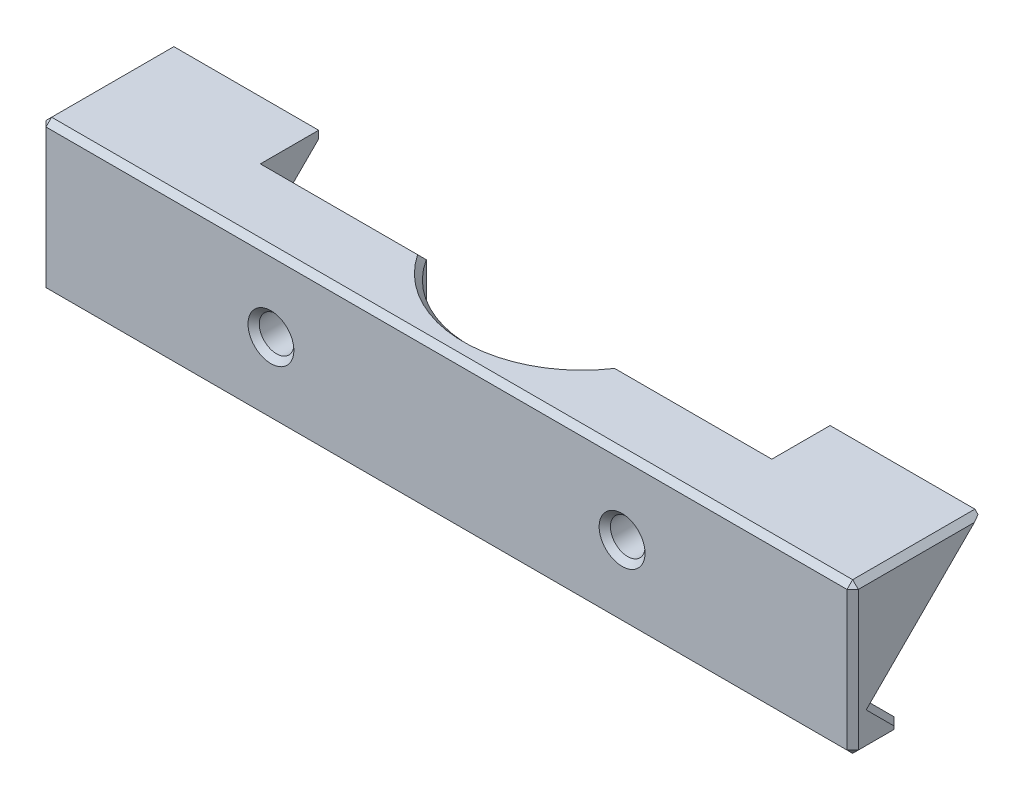
from build123d import *

# Parameters (mm, degrees)
SKIZZE1_W                       = 68
SKIZZE1_H                       = 20
AUFSATZ_LINEAR_AUSTRAGEN1_DEPTH = 10
AUFSATZ_LINEAR_AUSTRAGEN2_DEPTH = 20
SKIZZE3_R                       = 15
SCHNITT_LINEAR_AUSTRAGEN1_DEPTH = 20
SKIZZE4_R                       = 2.3
SCHNITT_LINEAR_AUSTRAGEN2_DEPTH = 10
SKIZZE5_R                       = 3.75
SCHNITT_LINEAR_AUSTRAGEN3_DEPTH = 3
SCHNITT_LINEAR_AUSTRAGEN4_DEPTH = 20
VERRUNDUNG1_R                   = 2


with BuildPart() as part:
    # Skizze1 → Aufsatz-Linear austragen1 (new body)
    with BuildSketch(Plane.XY):
        with Locations((0, 10)):
            Rectangle(SKIZZE1_W, SKIZZE1_H)
    extrude(amount=AUFSATZ_LINEAR_AUSTRAGEN1_DEPTH)

    # Skizze2 → Aufsatz-Linear austragen2 (add)
    with BuildSketch(Plane.ZY.offset(34)):
        Polygon((7.142135624, 4.857864376), (-7, 19), (-7, 20), (0, 20), (10, 20), (10, 0), (2.284271247, 0), align=None)
    aufsatz_linear_austragen2 = extrude(amount=AUFSATZ_LINEAR_AUSTRAGEN2_DEPTH)

    # Spiegeln1: Aufsatz-Linear austragen2 across plane
    add(aufsatz_linear_austragen2.mirror(Plane(origin=(0, 0, 0), x_dir=(0, 0, 1), z_dir=(1, 0, 0))))

    # Skizze3 → Schnitt-Linear austragen1 (cut)
    with BuildSketch(Plane.XZ):
        with Locations((0, -8)):
            Circle(SKIZZE3_R)
    extrude(amount=-SCHNITT_LINEAR_AUSTRAGEN1_DEPTH, mode=Mode.SUBTRACT)

    # Skizze4 → Schnitt-Linear austragen2 (cut)
    with BuildSketch(Plane(origin=(0, 0, 0), x_dir=(-1, 0, 0), z_dir=(0, 0, -1))):
        with Locations((-23.34428877, 10)):
            Circle(SKIZZE4_R)
        with Locations(Location((23.34428877, 10, 0), (0, 0, 180))):
            Circle(SKIZZE4_R)
    extrude(amount=-SCHNITT_LINEAR_AUSTRAGEN2_DEPTH, mode=Mode.SUBTRACT)

    # Skizze5 → Schnitt-Linear austragen3 (cut)
    with BuildSketch(Plane(origin=(0, 0, 0), x_dir=(-1, 0, 0), z_dir=(0, 0, -1))):
        with Locations((-23.34428877, 10)):
            Circle(SKIZZE5_R)
        with Locations((23.34428877, 10)):
            Circle(SKIZZE5_R)
    extrude(amount=-SCHNITT_LINEAR_AUSTRAGEN3_DEPTH, mode=Mode.SUBTRACT)

    # Skizze6 → Schnitt-Linear austragen4 (cut)
    with BuildSketch(Plane(origin=(54, 0, 0), x_dir=(0, 0, -1), z_dir=(1, 0, 0))):
        Polygon((-3.784271247, 1.5), (-3.784271247, 0), (-1.831080062, -0.949282867), (-1.396270995, 1.527811212), align=None)
    schnitt_linear_austragen4 = extrude(amount=-SCHNITT_LINEAR_AUSTRAGEN4_DEPTH, mode=Mode.SUBTRACT)

    # Spiegeln2: Schnitt-Linear austragen4 across plane
    add(schnitt_linear_austragen4.mirror(Plane(origin=(0, 0, 0), x_dir=(0, 0, 1), z_dir=(1, 0, 0))), mode=Mode.SUBTRACT)

    # Fase1
    # the kernel refuses this chamfer: 0.75 mm, written as the material it takes off along each edge
    with BuildSketch(Plane(origin=(53.5, 19.5, 9.5), x_dir=(-0.7071067811865476, 0.7071067811865476, 0), z_dir=(0.5773502691896257, 0.5773502691896257, 0.5773502691896257)), Plane(origin=(-53.5, 19.5, 9.5), x_dir=(-0.7071067811865476, -0.7071067811865476, 0), z_dir=(-0.5773502691896257, 0.5773502691896257, 0.5773502691896257))) as fase1_piece_1:
        Polygon((-0.530330086, -0.306186218), (0.530330086, -0.306186218), (0, 0.612372436), align=None)
    extrude(amount=0.952627944, mode=Mode.SUBTRACT)
    with BuildSketch(Plane(origin=(53.5, 0.5, 4.284271247), x_dir=(-0.7071067811865476, -1.2560739669470201e-15, -0.7071067811865476), z_dir=(0.5773502691896262, -0.577350269189626, -0.5773502691896252)), Plane(origin=(-53.5, 0.5, 9.5), x_dir=(-0.7071067811865476, 0.7071067811865474, 0), z_dir=(-0.5773502691896256, -0.5773502691896258, 0.5773502691896258)), Plane(origin=(-53.5, 0.5, 4.284271247), x_dir=(0, 0.707106781186547, -0.707106781186548), z_dir=(-0.577350269189626, -0.5773502691896262, -0.5773502691896253)), Plane(origin=(53.5, 0.5, 9.5), x_dir=(-0.7071067811865476, -0.7071067811865475, 0), z_dir=(0.5773502691896257, -0.5773502691896258, 0.5773502691896258))) as fase1_piece_2:
        Polygon((-0.530330086, 0.306186218), (0.530330086, 0.306186218), (0, -0.612372436), align=None)
    extrude(amount=0.952627944, mode=Mode.SUBTRACT)
    with BuildSketch(Plane(origin=(-23.34428877, 10, 10), x_dir=(1, 0, 0), z_dir=(0, 1, 0))) as fase1_piece_3:
        with BuildLine():
            Line((2.278786797, 0.771213203), (3.071213203, -0.021213203))
            Line((3.071213203, -0.021213203), (3.071213203, -0.036213203))
            ThreePointArc((3.071213203, -0.036213203), (2.685606602, -0.015), (2.3, -0.015))
            Line((2.3, -0.015), (2.285, 0))
            ThreePointArc((2.285, 0), (2.285, 0.385606602), (2.263786797, 0.771213203))
            Line((2.263786797, 0.771213203), (2.278786797, 0.771213203))
        make_face()
    revolve(axis=Axis((-23.34428877, 10, 10), (0, 0, -1)), mode=Mode.SUBTRACT)
    with BuildSketch(Plane(origin=(23.34428877, 10, 10), x_dir=(-1, 0, 0), z_dir=(0, -1, 0))) as fase1_piece_4:
        with BuildLine():
            Line((3.071213203, -0.021213203), (2.278786797, 0.771213203))
            Line((2.278786797, 0.771213203), (2.263786797, 0.771213203))
            ThreePointArc((2.263786797, 0.771213203), (2.285, 0.385606602), (2.285, 0))
            Line((2.285, 0), (2.3, -0.015))
            ThreePointArc((2.3, -0.015), (2.685606602, -0.015), (3.071213203, -0.036213203))
            Line((3.071213203, -0.036213203), (3.071213203, -0.021213203))
        make_face()
    revolve(axis=Axis((23.34428877, 10, 10), (0, 0, -1)), mode=Mode.SUBTRACT)
    with BuildSketch(Plane(origin=(54, 20, 0), x_dir=(-0.9996219169112968, 0.027495876610586893, 0), z_dir=(0, 0, 1))) as fase1_piece_5:
        with BuildLine():
            Line((0.771504896, 0), (-0.042410366, 0.770338345))
            Line((-0.042410366, 0.770338345), (-0.057404695, 0.769925907))
            ThreePointArc((-0.057404695, 0.769925907), (-0.02559692, 0.385048372), (-0.014994329, -0.000412438))
            Line((-0.014994329, -0.000412438), (0.000412438, -0.014994329))
            ThreePointArc((0.000412438, -0.014994329), (0.385873249, -0.004391737), (0.771917335, -0.014994329))
            Line((0.771917335, -0.014994329), (0.771504896, 0))
        make_face()
    extrude(amount=11.928762241, mode=Mode.SUBTRACT)
    with BuildSketch(Plane(origin=(54, 4.857864376, 7.142135624), x_dir=(-0.9996219169112968, -0.01944252080601377, -0.01944252080601398), z_dir=(0, 0.7071067811865513, -0.7071067811865438)), Plane(origin=(55.928762241, 0, 3.784271247), x_dir=(0, -0.027495876610586376, 0.9996219169112968), z_dir=(-1, 0, 0))) as fase1_piece_6:
        with BuildLine():
            Line((0.771504896, 0), (-0.042410366, 0.770338345))
            Line((-0.042410366, 0.770338345), (-0.057404695, 0.769925907))
            ThreePointArc((-0.057404695, 0.769925907), (-0.02559692, 0.385048372), (-0.014994329, -0.000412438))
            Line((-0.014994329, -0.000412438), (0.000412438, -0.014994329))
            ThreePointArc((0.000412438, -0.014994329), (0.385873249, -0.004391737), (0.771917335, -0.014994329))
            Line((0.771917335, -0.014994329), (0.771504896, 0))
        make_face()
    extrude(amount=21.928762241, mode=Mode.SUBTRACT)
    with BuildSketch(Plane(origin=(54, 0.13615914, 2.420430388), x_dir=(-0.9996219169112968, 0.01944252080601445, -0.019442520806014447), z_dir=(0, 0.7071067811865475, 0.7071067811865476))) as fase1_piece_7:
        with BuildLine():
            Line((0.771504896, 0), (-0.042410366, 0.770338345))
            Line((-0.042410366, 0.770338345), (-0.057404695, 0.769925907))
            ThreePointArc((-0.057404695, 0.769925907), (-0.02559692, 0.385048372), (-0.014994329, -0.000412438))
            Line((-0.014994329, -0.000412438), (0.000412438, -0.014994329))
            ThreePointArc((0.000412438, -0.014994329), (0.385873249, -0.004391737), (0.771917335, -0.014994329))
            Line((0.771917335, -0.014994329), (0.771504896, 0))
        make_face()
    extrude(amount=6.677499583, mode=Mode.SUBTRACT)
    with BuildSketch(Plane(origin=(54, 3.428762241, 3.784271247), x_dir=(0.027495876610582164, 0, 0.9996219169112969), z_dir=(0, -1, 0)), Plane(origin=(-54, 3.428762241, 3.784271247), x_dir=(0.9996219169112968, 0, -0.027495876610586317), z_dir=(0, -1, 0))) as fase1_piece_8:
        with BuildLine():
            Line((0.771504896, 0), (-0.042410366, 0.770338345))
            Line((-0.042410366, 0.770338345), (-0.057404695, 0.769925907))
            ThreePointArc((-0.057404695, 0.769925907), (-0.02559692, 0.385048372), (-0.014994329, -0.000412438))
            Line((-0.014994329, -0.000412438), (0.000412438, -0.014994329))
            ThreePointArc((0.000412438, -0.014994329), (0.385873249, -0.004391737), (0.771917335, -0.014994329))
            Line((0.771917335, -0.014994329), (0.771504896, 0))
        make_face()
    extrude(amount=5.357524482, mode=Mode.SUBTRACT)
    with BuildSketch(Plane(origin=(-54, 0, 11.928762241), x_dir=(0.9996219169112968, -0.027495876610586487, 0), z_dir=(0, 0, -1))) as fase1_piece_9:
        with BuildLine():
            Line((0.771504896, 0), (-0.042410366, -0.770338345))
            Line((-0.042410366, -0.770338345), (-0.057404695, -0.769925907))
            ThreePointArc((-0.057404695, -0.769925907), (-0.02559692, -0.385048372), (-0.014994329, 0.000412438))
            Line((-0.014994329, 0.000412438), (0.000412438, 0.014994329))
            ThreePointArc((0.000412438, 0.014994329), (0.385873249, 0.004391737), (0.771917335, 0.014994329))
            Line((0.771917335, 0.014994329), (0.771504896, 0))
        make_face()
    extrude(amount=10.073253234, mode=Mode.SUBTRACT)
    with BuildSketch(Plane(origin=(54, 21.928762241, 10), x_dir=(-0.9996219169112968, 0, 0.027495876610586893), z_dir=(0, -1, 0)), Plane(origin=(-54, 21.928762241, 10), x_dir=(-0.027495876610582164, 0, -0.9996219169112969), z_dir=(0, -1, 0))) as fase1_piece_10:
        with BuildLine():
            Line((0.771504896, 0), (-0.042410366, 0.770338345))
            Line((-0.042410366, 0.770338345), (-0.057404695, 0.769925907))
            ThreePointArc((-0.057404695, 0.769925907), (-0.02559692, 0.385048372), (-0.014994329, -0.000412438))
            Line((-0.014994329, -0.000412438), (0.000412438, -0.014994329))
            ThreePointArc((0.000412438, -0.014994329), (0.385873249, -0.004391737), (0.771917335, -0.014994329))
            Line((0.771917335, -0.014994329), (0.771504896, 0))
        make_face()
    extrude(amount=23.857524482, mode=Mode.SUBTRACT)
    with BuildSketch(Plane(origin=(55.928762241, 20, 10), x_dir=(0, 0.027495876610586768, -0.9996219169112968), z_dir=(-1, 0, 0))) as fase1_piece_11:
        with BuildLine():
            Line((0.771504896, 0), (-0.042410366, 0.770338345))
            Line((-0.042410366, 0.770338345), (-0.057404695, 0.769925907))
            ThreePointArc((-0.057404695, 0.769925907), (-0.02559692, 0.385048372), (-0.014994329, -0.000412438))
            Line((-0.014994329, -0.000412438), (0.000412438, -0.014994329))
            ThreePointArc((0.000412438, -0.014994329), (0.385873249, -0.004391737), (0.771917335, -0.014994329))
            Line((0.771917335, -0.014994329), (0.771504896, 0))
        make_face()
    extrude(amount=111.857524482, mode=Mode.SUBTRACT)
    with BuildSketch(Plane(origin=(55.928762241, 0, 10), x_dir=(0, -0.02749587661058636, -0.9996219169112968), z_dir=(-1, 0, 0))) as fase1_piece_12:
        with BuildLine():
            Line((0.771504896, 0), (-0.042410366, -0.770338345))
            Line((-0.042410366, -0.770338345), (-0.057404695, -0.769925907))
            ThreePointArc((-0.057404695, -0.769925907), (-0.02559692, -0.385048372), (-0.014994329, 0.000412438))
            Line((-0.014994329, 0.000412438), (0.000412438, 0.014994329))
            ThreePointArc((0.000412438, 0.014994329), (0.385873249, 0.004391737), (0.771917335, 0.014994329))
            Line((0.771917335, 0.014994329), (0.771504896, 0))
        make_face()
    extrude(amount=111.857524482, mode=Mode.SUBTRACT)
    with BuildSketch(Plane(origin=(54, 0, 11.928762241), x_dir=(-0.9996219169112968, -0.027495876610586487, 0), z_dir=(0, 0, -1))) as fase1_piece_13:
        with BuildLine():
            Line((0.771504896, 0), (-0.042410366, 0.770338345))
            Line((-0.042410366, 0.770338345), (-0.057404695, 0.769925907))
            ThreePointArc((-0.057404695, 0.769925907), (-0.02559692, 0.385048372), (-0.014994329, -0.000412438))
            Line((-0.014994329, -0.000412438), (0.000412438, -0.014994329))
            ThreePointArc((0.000412438, -0.014994329), (0.385873249, -0.004391737), (0.771917335, -0.014994329))
            Line((0.771917335, -0.014994329), (0.771504896, 0))
        make_face()
    extrude(amount=10.073253234, mode=Mode.SUBTRACT)
    with BuildSketch(Plane(origin=(34, 0, -1.928762241), x_dir=(-0.9996219169112968, -0.027495876610586487, 0), z_dir=(0, 0, 1)), Plane(origin=(-34, 0, 3.784271247), x_dir=(0.9996219169112968, -0.027495876610585248, 0), z_dir=(0, 0, -1))) as fase1_piece_14:
        with BuildLine():
            Line((0.771504896, 0), (-0.042410366, -0.770338345))
            Line((-0.042410366, -0.770338345), (-0.057404695, -0.769925907))
            ThreePointArc((-0.057404695, -0.769925907), (-0.02559692, -0.385048372), (-0.014994329, 0.000412438))
            Line((-0.014994329, 0.000412438), (0.000412438, 0.014994329))
            ThreePointArc((0.000412438, 0.014994329), (0.385873249, 0.004391737), (0.771917335, 0.014994329))
            Line((0.771917335, 0.014994329), (0.771504896, 0))
        make_face()
    extrude(amount=5.713033488, mode=Mode.SUBTRACT)
    with BuildSketch(Plane(origin=(35.928762241, 0, 0), x_dir=(0, -0.027495876610586372, 0.9996219169112968), z_dir=(-1, 0, 0)), Plane(origin=(-10.759815299, 0, 0), x_dir=(0, -0.027495876610586372, 0.9996219169112968), z_dir=(-1, 0, 0))) as fase1_piece_15:
        with BuildLine():
            Line((0.771504896, 0), (-0.042410366, 0.770338345))
            Line((-0.042410366, 0.770338345), (-0.057404695, 0.769925907))
            ThreePointArc((-0.057404695, 0.769925907), (-0.02559692, 0.385048372), (-0.014994329, -0.000412438))
            Line((-0.014994329, -0.000412438), (0.000412438, -0.014994329))
            ThreePointArc((0.000412438, -0.014994329), (0.385873249, -0.004391737), (0.771917335, -0.014994329))
            Line((0.771917335, -0.014994329), (0.771504896, 0))
        make_face()
    extrude(amount=25.168946941, mode=Mode.SUBTRACT)
    with BuildSketch(Plane(origin=(0, 0, -8), x_dir=(0.9073469377071577, 0, 0.42038260505573166), z_dir=(0.42038260505573166, 0, -0.9073469377071577))) as fase1_piece_16:
        with BuildLine():
            Line((15.771213203, 0.021213203), (14.978786797, -0.771213203))
            Line((14.978786797, -0.771213203), (14.963786797, -0.771213203))
            ThreePointArc((14.963786797, -0.771213203), (14.985, -0.385606602), (14.985, 0))
            Line((14.985, 0), (15, 0.015))
            ThreePointArc((15, 0.015), (15.385606602, 0.015), (15.771213203, 0.036213203))
            Line((15.771213203, 0.036213203), (15.771213203, 0.021213203))
        make_face()
    revolve(axis=Axis((0, 0, -8), (0, -1, 0)), revolution_arc=130.282509401, mode=Mode.SUBTRACT)
    with BuildSketch(Plane(origin=(-55.928762241, 0, 3.784271247), x_dir=(0, -0.027495876610586376, 0.9996219169112968), z_dir=(1, 0, 0)), Plane(origin=(-54, 4.857864376, 7.142135624), x_dir=(0.9996219169112968, -0.01944252080601377, -0.01944252080601398), z_dir=(0, 0.7071067811865513, -0.7071067811865438))) as fase1_piece_17:
        with BuildLine():
            Line((0.771504896, 0), (-0.042410366, -0.770338345))
            Line((-0.042410366, -0.770338345), (-0.057404695, -0.769925907))
            ThreePointArc((-0.057404695, -0.769925907), (-0.02559692, -0.385048372), (-0.014994329, 0.000412438))
            Line((-0.014994329, 0.000412438), (0.000412438, 0.014994329))
            ThreePointArc((0.000412438, 0.014994329), (0.385873249, 0.004391737), (0.771917335, 0.014994329))
            Line((0.771917335, 0.014994329), (0.771504896, 0))
        make_face()
    extrude(amount=21.928762241, mode=Mode.SUBTRACT)
    with BuildSketch(Plane(origin=(-54, 0.13615914, 2.420430388), x_dir=(0.9996219169112968, 0.01944252080601436, -0.019442520806014357), z_dir=(0, 0.7071067811865475, 0.7071067811865476))) as fase1_piece_18:
        with BuildLine():
            Line((0.771504896, 0), (-0.042410366, -0.770338345))
            Line((-0.042410366, -0.770338345), (-0.057404695, -0.769925907))
            ThreePointArc((-0.057404695, -0.769925907), (-0.02559692, -0.385048372), (-0.014994329, 0.000412438))
            Line((-0.014994329, 0.000412438), (0.000412438, 0.014994329))
            ThreePointArc((0.000412438, 0.014994329), (0.385873249, 0.004391737), (0.771917335, 0.014994329))
            Line((0.771917335, 0.014994329), (0.771504896, 0))
        make_face()
    extrude(amount=6.677499583, mode=Mode.SUBTRACT)
    with BuildSketch(Plane(origin=(-34, 20, 0), x_dir=(0, 0.027495876610586778, 0.9996219169112968), z_dir=(1, 0, 0)), Plane(origin=(10.759815299, 20, 0), x_dir=(0, 0.027495876610586778, 0.9996219169112968), z_dir=(1, 0, 0))) as fase1_piece_19:
        with BuildLine():
            Line((0.771504896, 0), (-0.042410366, 0.770338345))
            Line((-0.042410366, 0.770338345), (-0.057404695, 0.769925907))
            ThreePointArc((-0.057404695, 0.769925907), (-0.02559692, 0.385048372), (-0.014994329, -0.000412438))
            Line((-0.014994329, -0.000412438), (0.000412438, -0.014994329))
            ThreePointArc((0.000412438, -0.014994329), (0.385873249, -0.004391737), (0.771917335, -0.014994329))
            Line((0.771917335, -0.014994329), (0.771504896, 0))
        make_face()
    extrude(amount=23.240184701, mode=Mode.SUBTRACT)
    with BuildSketch(Plane(origin=(0, 20, -8), x_dir=(0.9073469377071578, 0, 0.42038260505573166), z_dir=(0.42038260505573166, 0, -0.9073469377071578))) as fase1_piece_20:
        with BuildLine():
            Line((14.978786797, 0.771213203), (15.771213203, -0.021213203))
            Line((15.771213203, -0.021213203), (15.771213203, -0.036213203))
            ThreePointArc((15.771213203, -0.036213203), (15.385606602, -0.015), (15, -0.015))
            Line((15, -0.015), (14.985, 0))
            ThreePointArc((14.985, 0), (14.985, 0.385606602), (14.963786797, 0.771213203))
            Line((14.963786797, 0.771213203), (14.978786797, 0.771213203))
        make_face()
    revolve(axis=Axis((0, 20, -8), (0, -1, 0)), revolution_arc=130.282509401, mode=Mode.SUBTRACT)
    with BuildSketch(Plane(origin=(-54, 20, 0), x_dir=(0.9996219169112968, 0.027495876610586893, 0), z_dir=(0, 0, 1))) as fase1_piece_21:
        with BuildLine():
            Line((0.771504896, 0), (-0.042410366, -0.770338345))
            Line((-0.042410366, -0.770338345), (-0.057404695, -0.769925907))
            ThreePointArc((-0.057404695, -0.769925907), (-0.02559692, -0.385048372), (-0.014994329, 0.000412438))
            Line((-0.014994329, 0.000412438), (0.000412438, 0.014994329))
            ThreePointArc((0.000412438, 0.014994329), (0.385873249, 0.004391737), (0.771917335, 0.014994329))
            Line((0.771917335, 0.014994329), (0.771504896, 0))
        make_face()
    extrude(amount=11.928762241, mode=Mode.SUBTRACT)
    with BuildSketch(Plane(origin=(-54, 20, -8.928762241), x_dir=(0.9996219169112968, 0.027495876610586893, -2.912407812628222e-14), z_dir=(0, 1.059216206806384e-12, 1.0))) as fase1_piece_22:
        with BuildLine():
            Line((0.771504896, 0), (-0.042410366, -0.770338345))
            Line((-0.042410366, -0.770338345), (-0.057404695, -0.769925907))
            ThreePointArc((-0.057404695, -0.769925907), (-0.02559692, -0.385048372), (-0.014994329, 0.000412438))
            Line((-0.014994329, 0.000412438), (0.000412438, 0.014994329))
            ThreePointArc((0.000412438, 0.014994329), (0.385873249, 0.004391737), (0.771917335, 0.014994329))
            Line((0.771917335, 0.014994329), (0.771504896, 0))
        make_face()
    extrude(amount=8.928762241, mode=Mode.SUBTRACT)
    with BuildSketch(Plane(origin=(54, 20, -8.928762241), x_dir=(-0.9996219169112968, 0.027495876610586893, -2.912407812628222e-14), z_dir=(0, 1.059216206806384e-12, 1.0))) as fase1_piece_23:
        with BuildLine():
            Line((0.771504896, 0), (-0.042410366, 0.770338345))
            Line((-0.042410366, 0.770338345), (-0.057404695, 0.769925907))
            ThreePointArc((-0.057404695, 0.769925907), (-0.02559692, 0.385048372), (-0.014994329, -0.000412438))
            Line((-0.014994329, -0.000412438), (0.000412438, -0.014994329))
            ThreePointArc((0.000412438, -0.014994329), (0.385873249, -0.004391737), (0.771917335, -0.014994329))
            Line((0.771917335, -0.014994329), (0.771504896, 0))
        make_face()
    extrude(amount=8.928762241, mode=Mode.SUBTRACT)
    with BuildSketch(Plane(origin=(54, 3.494023516, 8.505976484), x_dir=(-0.9996219169112968, -0.01944252080601521, -0.019442520806015415), z_dir=(0, 0.7071067811865513, -0.7071067811865438))) as fase1_piece_24a_section:
        with BuildLine():
            Line((0.771504896, 0), (-0.042410366, 0.770338345))
            Line((-0.042410366, 0.770338345), (-0.057404695, 0.769925907))
            ThreePointArc((-0.057404695, 0.769925907), (-0.02559692, 0.385048372), (-0.014994329, -0.000412438))
            Line((-0.014994329, -0.000412438), (0.000412438, -0.014994329))
            ThreePointArc((0.000412438, -0.014994329), (0.385873249, -0.004391737), (0.771917335, -0.014994329))
            Line((0.771917335, -0.014994329), (0.771504896, 0))
        make_face()
    fase1_piece_24a = extrude(amount=23.857524482, mode=Mode.PRIVATE)
    fase1_piece_24a = split(fase1_piece_24a, bisect_by=Plane(origin=(53.75265478, 5.032763859, 7.317035106), z_dir=(0, -0.7071067811865476, 0.7071067811865475)), keep=Keep.TOP, mode=Mode.PRIVATE)
    with BuildSketch(Plane(origin=(54, 0.13615914, 2.420430388), x_dir=(-0.9996219169112968, 0.01944252080601445, -0.019442520806014447), z_dir=(0, 0.7071067811865475, 0.7071067811865476))) as fase1_piece_24b_section:
        with BuildLine():
            Line((0.771504896, 0), (-0.042410366, 0.770338345))
            Line((-0.042410366, 0.770338345), (-0.057404695, 0.769925907))
            ThreePointArc((-0.057404695, 0.769925907), (-0.02559692, 0.385048372), (-0.014994329, -0.000412438))
            Line((-0.014994329, -0.000412438), (0.000412438, -0.014994329))
            ThreePointArc((0.000412438, -0.014994329), (0.385873249, -0.004391737), (0.771917335, -0.014994329))
            Line((0.771917335, -0.014994329), (0.771504896, 0))
        make_face()
    fase1_piece_24b = extrude(amount=8.606261823, mode=Mode.PRIVATE)
    fase1_piece_24b = split(fase1_piece_24b, bisect_by=Plane(origin=(53.75265478, 4.682964894, 7.317035106), z_dir=(0, 0.7071067811865438, 0.7071067811865513)), keep=Keep.TOP, mode=Mode.PRIVATE)
    fase1_piece_24 = fase1_piece_24a & fase1_piece_24b
    add(fase1_piece_24, mode=Mode.SUBTRACT)
    with BuildSketch(Plane(origin=(34, 0, -1.928762241), x_dir=(-0.9996219169112968, -0.027495876610586487, 0), z_dir=(0, 0, 1))) as fase1_piece_25a_section:
        with BuildLine():
            Line((0.771504896, 0), (-0.042410366, -0.770338345))
            Line((-0.042410366, -0.770338345), (-0.057404695, -0.769925907))
            ThreePointArc((-0.057404695, -0.769925907), (-0.02559692, -0.385048372), (-0.014994329, 0.000412438))
            Line((-0.014994329, 0.000412438), (0.000412438, 0.014994329))
            ThreePointArc((0.000412438, 0.014994329), (0.385873249, 0.004391737), (0.771917335, 0.014994329))
            Line((0.771917335, 0.014994329), (0.771504896, 0))
        make_face()
    fase1_piece_25a = extrude(amount=7.641795729, mode=Mode.PRIVATE)
    fase1_piece_25a = split(fase1_piece_25a, bisect_by=Plane(origin=(33.75265478, 0.24734522, 3.784271247), z_dir=(0, 0, 1)), keep=Keep.TOP, mode=Mode.PRIVATE)
    with BuildSketch(Plane(origin=(55.928762241, 0, 3.784271247), x_dir=(0, -0.027495876610586376, 0.9996219169112968), z_dir=(-1, 0, 0))) as fase1_piece_25b_section:
        with BuildLine():
            Line((0.771504896, 0), (-0.042410366, 0.770338345))
            Line((-0.042410366, 0.770338345), (-0.057404695, 0.769925907))
            ThreePointArc((-0.057404695, 0.769925907), (-0.02559692, 0.385048372), (-0.014994329, -0.000412438))
            Line((-0.014994329, -0.000412438), (0.000412438, -0.014994329))
            ThreePointArc((0.000412438, -0.014994329), (0.385873249, -0.004391737), (0.771917335, -0.014994329))
            Line((0.771917335, -0.014994329), (0.771504896, 0))
        make_face()
    fase1_piece_25b = extrude(amount=23.857524482, mode=Mode.PRIVATE)
    fase1_piece_25b = split(fase1_piece_25b, bisect_by=Plane(origin=(34, 0.24734522, 4.031616468), z_dir=(-1, 0, 0)), keep=Keep.TOP, mode=Mode.PRIVATE)
    fase1_piece_25 = fase1_piece_25a & fase1_piece_25b
    add(fase1_piece_25, mode=Mode.SUBTRACT)
    with BuildSketch(Plane(origin=(-55.928762241, 0, 3.784271247), x_dir=(0, -0.027495876610586376, 0.9996219169112968), z_dir=(1, 0, 0))) as fase1_piece_26a_section:
        with BuildLine():
            Line((0.771504896, 0), (-0.042410366, -0.770338345))
            Line((-0.042410366, -0.770338345), (-0.057404695, -0.769925907))
            ThreePointArc((-0.057404695, -0.769925907), (-0.02559692, -0.385048372), (-0.014994329, 0.000412438))
            Line((-0.014994329, 0.000412438), (0.000412438, 0.014994329))
            ThreePointArc((0.000412438, 0.014994329), (0.385873249, 0.004391737), (0.771917335, 0.014994329))
            Line((0.771917335, 0.014994329), (0.771504896, 0))
        make_face()
    fase1_piece_26a = extrude(amount=23.857524482, mode=Mode.PRIVATE)
    fase1_piece_26a = split(fase1_piece_26a, bisect_by=Plane(origin=(-34, 0.24734522, 4.031616468), z_dir=(1, 0, 0)), keep=Keep.TOP, mode=Mode.PRIVATE)
    with BuildSketch(Plane(origin=(-34, 0, 5.713033488), x_dir=(0.9996219169112968, -0.027495876610586487, 0), z_dir=(0, 0, -1))) as fase1_piece_26b_section:
        with BuildLine():
            Line((0.771504896, 0), (-0.042410366, -0.770338345))
            Line((-0.042410366, -0.770338345), (-0.057404695, -0.769925907))
            ThreePointArc((-0.057404695, -0.769925907), (-0.02559692, -0.385048372), (-0.014994329, 0.000412438))
            Line((-0.014994329, 0.000412438), (0.000412438, 0.014994329))
            ThreePointArc((0.000412438, 0.014994329), (0.385873249, 0.004391737), (0.771917335, 0.014994329))
            Line((0.771917335, 0.014994329), (0.771504896, 0))
        make_face()
    fase1_piece_26b = extrude(amount=7.641795729, mode=Mode.PRIVATE)
    fase1_piece_26b = split(fase1_piece_26b, bisect_by=Plane(origin=(-33.75265478, 0.24734522, 3.784271247), z_dir=(0, 0, 1)), keep=Keep.TOP, mode=Mode.PRIVATE)
    fase1_piece_26 = fase1_piece_26a & fase1_piece_26b
    add(fase1_piece_26, mode=Mode.SUBTRACT)
    with BuildSketch(Plane(origin=(-54, 3.494023516, 8.505976484), x_dir=(0.9996219169112968, -0.019442520806014923, -0.019442520806015127), z_dir=(0, 0.7071067811865513, -0.7071067811865438))) as fase1_piece_27a_section:
        with BuildLine():
            Line((0.771504896, 0), (-0.042410366, -0.770338345))
            Line((-0.042410366, -0.770338345), (-0.057404695, -0.769925907))
            ThreePointArc((-0.057404695, -0.769925907), (-0.02559692, -0.385048372), (-0.014994329, 0.000412438))
            Line((-0.014994329, 0.000412438), (0.000412438, 0.014994329))
            ThreePointArc((0.000412438, 0.014994329), (0.385873249, 0.004391737), (0.771917335, 0.014994329))
            Line((0.771917335, 0.014994329), (0.771504896, 0))
        make_face()
    fase1_piece_27a = extrude(amount=23.857524482, mode=Mode.PRIVATE)
    fase1_piece_27a = split(fase1_piece_27a, bisect_by=Plane(origin=(-53.75265478, 5.032763859, 7.317035106), z_dir=(0, -0.7071067811865476, 0.7071067811865475)), keep=Keep.TOP, mode=Mode.PRIVATE)
    with BuildSketch(Plane(origin=(-54, 0.13615914, 2.420430388), x_dir=(0.9996219169112968, 0.01944252080601436, -0.019442520806014357), z_dir=(0, 0.7071067811865475, 0.7071067811865476))) as fase1_piece_27b_section:
        with BuildLine():
            Line((0.771504896, 0), (-0.042410366, -0.770338345))
            Line((-0.042410366, -0.770338345), (-0.057404695, -0.769925907))
            ThreePointArc((-0.057404695, -0.769925907), (-0.02559692, -0.385048372), (-0.014994329, 0.000412438))
            Line((-0.014994329, 0.000412438), (0.000412438, 0.014994329))
            ThreePointArc((0.000412438, 0.014994329), (0.385873249, 0.004391737), (0.771917335, 0.014994329))
            Line((0.771917335, 0.014994329), (0.771504896, 0))
        make_face()
    fase1_piece_27b = extrude(amount=8.606261823, mode=Mode.PRIVATE)
    fase1_piece_27b = split(fase1_piece_27b, bisect_by=Plane(origin=(-53.75265478, 4.682964894, 7.317035106), z_dir=(0, 0.7071067811865438, 0.7071067811865513)), keep=Keep.TOP, mode=Mode.PRIVATE)
    fase1_piece_27 = fase1_piece_27a & fase1_piece_27b
    add(fase1_piece_27, mode=Mode.SUBTRACT)

    # Verrundung1
    verrundung1_edges = [part.edges().sort_by_distance(p)[0] for p in [
        (-34, 15.625, 0),
        (34, 15.625, 0),
    ]]
    fillet(verrundung1_edges, radius=VERRUNDUNG1_R)


solid = part.part
